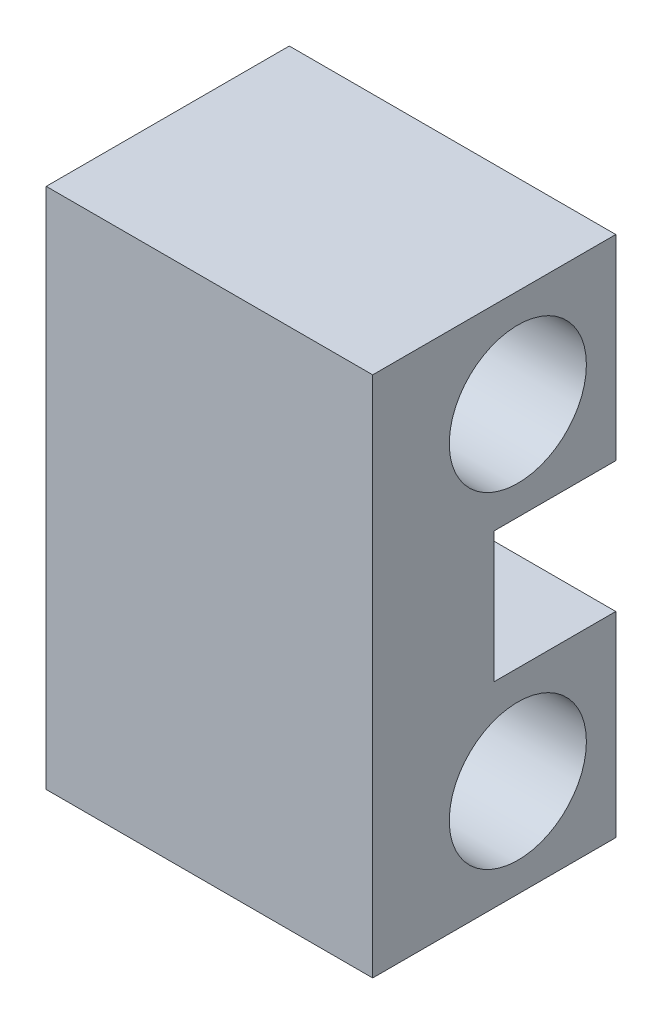
from build123d import *

# Parameters (mm, degrees)
SKETCH_1_R      = 10.5
EXTRUDE_2_DEPTH = 50


with BuildPart() as part:
    # Эскиз1 → Бобышка-Вытянуть2 (new body)
    with BuildSketch(Plane(origin=(0, 0, 0), x_dir=(0, 0, -1), z_dir=(1, 0, 0))):
        Polygon((0, 0), (0, 80), (37.228405767, 80), (37.228405767, 50), (18.614202884, 50), (18.614202884, 30), (37.228405767, 30), (37.228405767, 0), align=None)
        with Locations((22.228405767, 15)):
            Circle(SKETCH_1_R, mode=Mode.SUBTRACT)
        with Locations((22.228405767, 65)):
            Circle(SKETCH_1_R, mode=Mode.SUBTRACT)
    extrude(amount=EXTRUDE_2_DEPTH)


solid = part.part
